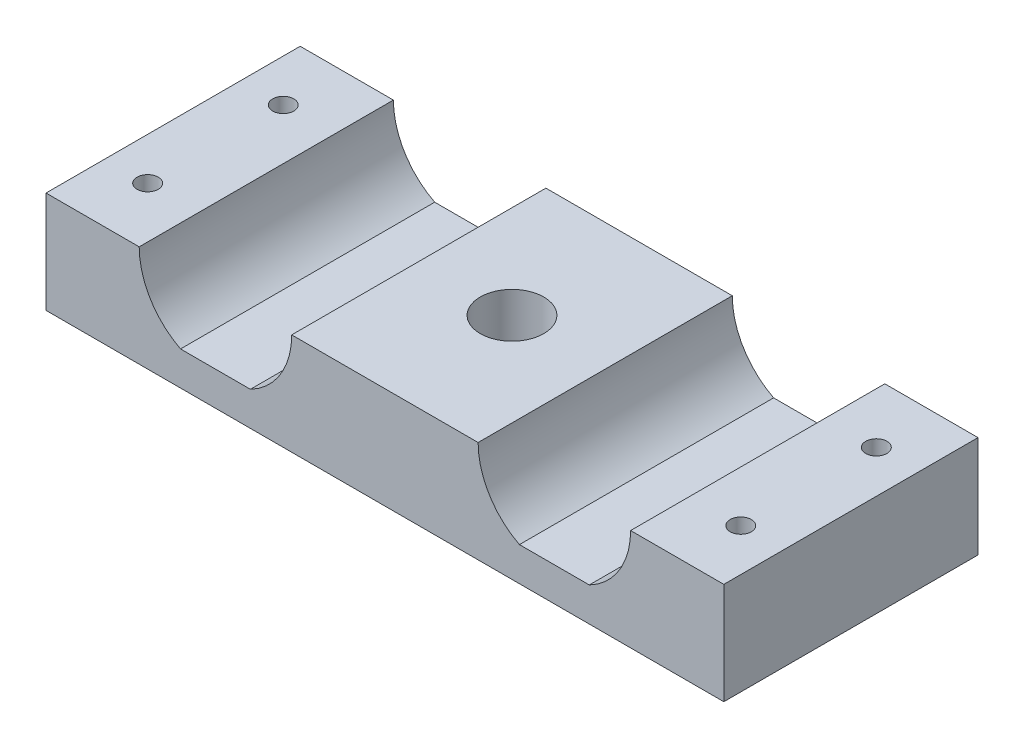
from build123d import *

# Parameters (mm, degrees)
BOSS_EXTRUDE1_DEPTH  = 38.1
HOLE1_D              = 9.525
HOLE1_DEPTH          = 101.6
HOLE2_D              = 3.175
HOLE2_DEPTH          = 101.6
LPATTERN1_COUNT      = 2
LPATTERN1_PITCH      = 20.32
LPATTERN1_COUNT_DIR2 = 2
LPATTERN1_PITCH_DIR2 = 88.9


with BuildPart() as part:
    # Sketch1 → Boss-Extrude1 (new body)
    with BuildSketch(Plane.XY):
        with BuildLine():
            Line((-50.8, 0), (50.8, 0))
            Line((50.8, 0), (50.8, 15.24))
            Line((50.8, 15.24), (36.83, 15.24))
            ThreePointArc((36.83, 15.24), (35.159516217, 9.290483783), (30.636344145, 5.08))
            Line((30.636344145, 5.08), (20.163655855, 5.08))
            ThreePointArc((20.163655855, 5.08), (15.640483783, 9.290483783), (13.97, 15.24))
            Line((13.97, 15.24), (-13.97, 15.24))
            ThreePointArc((-13.97, 15.24), (-15.640483783, 9.290483783), (-20.163655855, 5.08))
            Line((-20.163655855, 5.08), (-30.636344145, 5.08))
            ThreePointArc((-30.636344145, 5.08), (-35.159516217, 9.290483783), (-36.83, 15.24))
            Line((-36.83, 15.24), (-50.8, 15.24))
            Line((-50.8, 15.24), (-50.8, 0))
        make_face()
    extrude(amount=BOSS_EXTRUDE1_DEPTH)

    # Hole1
    with Locations(Plane(origin=(0, 15.24, 0), x_dir=(1, 0, 0), z_dir=(0, 1, 0))):
        with Locations((0, -19.05)):
            Hole(HOLE1_D / 2, depth=HOLE1_DEPTH)

    # Hole2
    with Locations(Plane(origin=(0, 15.24, 0), x_dir=(1, 0, 0), z_dir=(0, 1, 0))):
        with Locations((-44.45, -8.89)):
            hole2 = Hole(HOLE2_D / 2, depth=HOLE2_DEPTH)

    # LPattern1: Hole2 2 × 2
    with Locations(*[(j * LPATTERN1_PITCH_DIR2, 0, i * LPATTERN1_PITCH) for i in range(LPATTERN1_COUNT) for j in range(LPATTERN1_COUNT_DIR2) if (i, j) != (0, 0)]):
        add(hole2, mode=Mode.SUBTRACT)


solid = part.part
